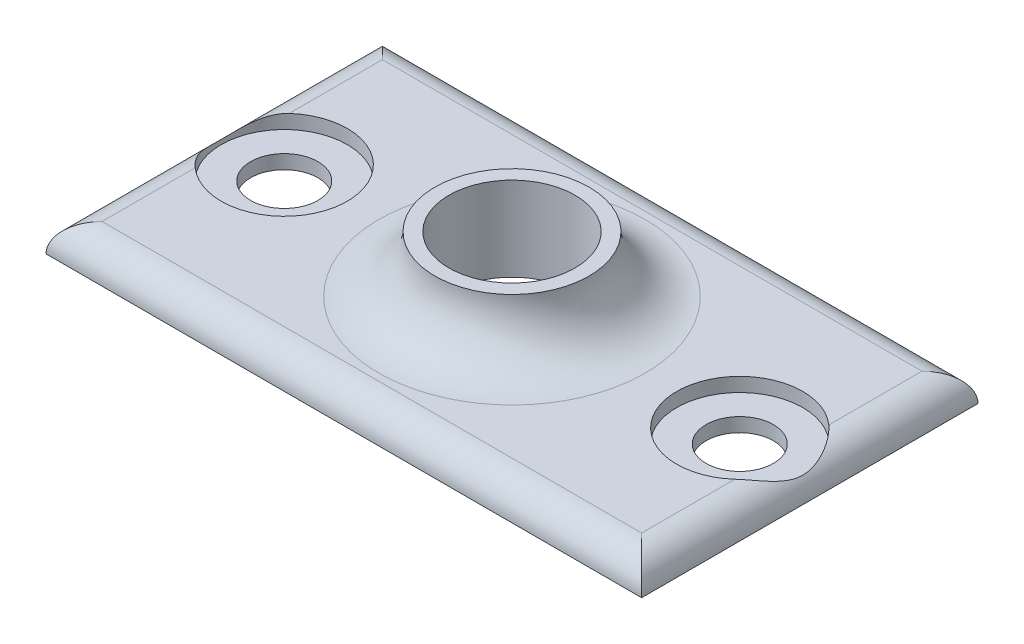
from build123d import *
from build123d.topology import SkipClean

# Parameters (mm, degrees)
SKETCH1_W            = 42.5
SKETCH1_H            = 24
SKETCH1_R            = 4.5
BOSS_EXTRUDE1_DEPTH  = 2
SKETCH1_2_R          = 4.5
BOSS_EXTRUDE2_DEPTH  = 1
SKETCH2_W            = 1
SKETCH2_H            = 4
FILLET3_START        = -12
FILLET3_DEPTH        = 24
FILLET3_START_2      = -22
FILLET3_2_DEPTH      = 44
FILLET2_R            = 4
M4_CLEARANCE_HOLE1_D = 4.8


with BuildPart() as part:
    # Sketch1 → Boss-Extrude1 (new body)
    with BuildSketch(Plane(origin=(0, 0, 0), x_dir=(1, 0, 0), z_dir=(0, 1, 0))):
        Rectangle(SKETCH1_W, SKETCH1_H)
        with Locations(Location((0, 0, 0), (0, 0, 270))):
            Circle(SKETCH1_R, mode=Mode.SUBTRACT)
        with Locations(Location((16.25, 0, 0), (0, 0, 270))):
            Circle(SKETCH1_R, mode=Mode.SUBTRACT)
        with Locations(Location((-16.25, 0, 0), (0, 0, 270))):
            Circle(SKETCH1_R, mode=Mode.SUBTRACT)
    extrude(amount=BOSS_EXTRUDE1_DEPTH)

    # Sketch1<2> → Boss-Extrude2 (add)
    with BuildSketch(Plane(origin=(0, 0, 0), x_dir=(1, 0, 0), z_dir=(0, 1, 0))):
        with Locations(Location((16.25, 0, 0), (0, 0, 270))):
            Circle(SKETCH1_2_R)
        with Locations(Location((-16.25, 0, 0), (0, 0, 270))):
            Circle(SKETCH1_2_R)
    extrude(amount=BOSS_EXTRUDE2_DEPTH)

    # Sketch2 → Revolve1 (revolve)
    with SkipClean():  # the faces are left unmerged after this step: merging them gives an invalid solid
        with BuildSketch(Plane.XY, mode=Mode.PRIVATE) as revolve1_sk:
            with Locations((-5, 4)):
                Rectangle(SKETCH2_W, SKETCH2_H)
        revolve(revolve1_sk.sketch.rotate(Axis((0, 0, 0), (0, 1, 0)), 270), axis=Axis((0, 0, 0), (0, 1, 0)))
    add(part.part.scale(1), mode=Mode.REPLACE)  # the faces are merged on a copy

    # Fillet3: read off the stored shape, not the designer's step
    # Fillet3 outline → Fillet3 (cut)
    with BuildSketch(Plane.XY.offset(FILLET3_START)):
        with BuildLine():
            Line((21.25, 2), (19.25, 2))
            ThreePointArc((19.25, 2), (20.664213562, 1.414213562), (21.25, 0))
            Line((21.25, 0), (21.25, 2))
        make_face()
        with BuildLine():
            ThreePointArc((-21.25, 0), (-20.664213562, 1.414213562), (-19.25, 2))
            Line((-19.25, 2), (-21.25, 2))
            Line((-21.25, 2), (-21.25, 0))
        make_face()
    extrude(amount=FILLET3_DEPTH, mode=Mode.SUBTRACT)

    # Fillet3 2 outline → Fillet3 2 (cut)
    with BuildSketch(Plane.YZ.offset(FILLET3_START_2)):
        with BuildLine():
            Line((2, -12), (2, -10))
            ThreePointArc((2, -10), (1.414213562, -11.414213562), (0, -12))
            Line((0, -12), (2, -12))
        make_face()
        with BuildLine():
            ThreePointArc((0, 12), (1.414213562, 11.414213562), (2, 10))
            Line((2, 10), (2, 12))
            Line((2, 12), (0, 12))
        make_face()
    extrude(amount=FILLET3_2_DEPTH, mode=Mode.SUBTRACT)

    # Fillet2
    fillet2_edges = [part.edges().sort_by_distance(p)[0] for p in [
        (0, 2, 5.5),
    ]]
    fillet(fillet2_edges, radius=FILLET2_R - 0.0001)  # a hair under: the kernel refuses the full size

    # M4 Clearance Hole1 (through all)
    with Locations(Plane(origin=(0, 0, 0), x_dir=(-1, 0, 0), z_dir=(0, -1, 0))):
        with Locations((-16.25, 0), (16.25, 0)):
            Hole(M4_CLEARANCE_HOLE1_D / 2)


solid = part.part
